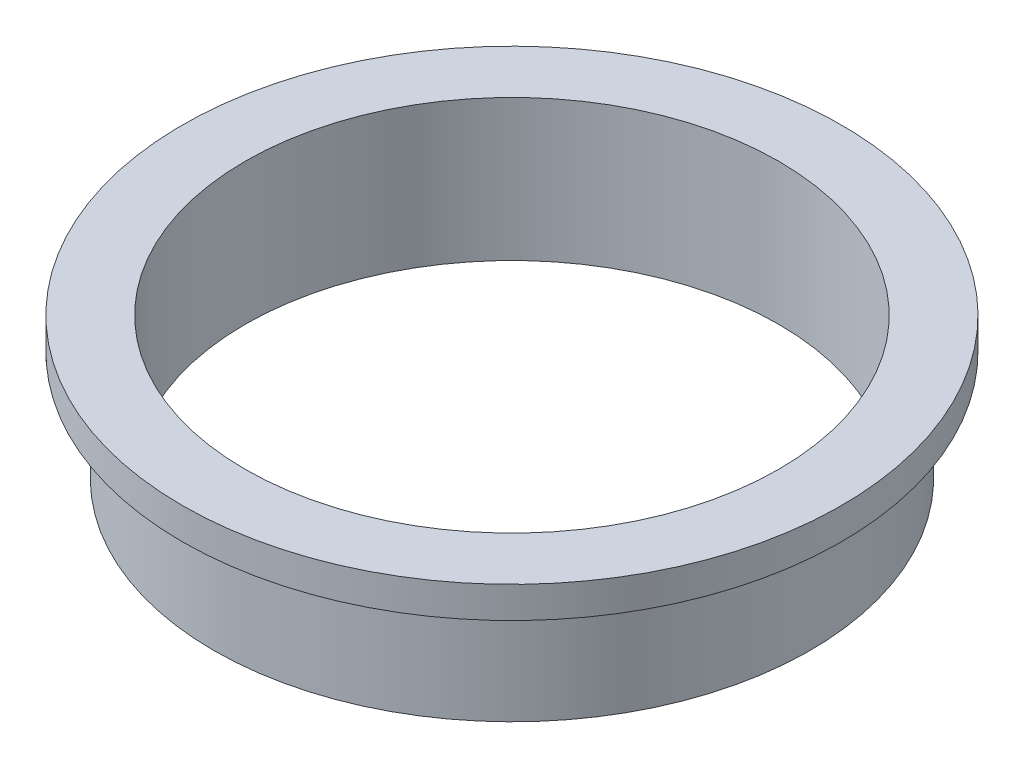
from build123d import *

# Parameters (mm, degrees)
CROQUIS1_R              = 9.5
CROQUIS1_R_2            = 8.5
SALIENTE_EXTRUIR1_DEPTH = 4.5
SALIENTE_EXTRUIR2_START = -1
CROQUIS2_R              = 10.5
CROQUIS2_R_2            = 8.5
SALIENTE_EXTRUIR2_DEPTH = 1


with BuildPart() as part:
    # Croquis1 → Saliente-Extruir1 (new body)
    with BuildSketch(Plane(origin=(0, 0, 0), x_dir=(1, 0, 0), z_dir=(0, 1, 0))):
        Circle(CROQUIS1_R)
        Circle(CROQUIS1_R_2, mode=Mode.SUBTRACT)
    extrude(amount=SALIENTE_EXTRUIR1_DEPTH)

    # Croquis2 → Saliente-Extruir2 (add)
    with BuildSketch(Plane(origin=(0, 4.5, 0), x_dir=(1, 0, 0), z_dir=(0, 1, 0)).offset(SALIENTE_EXTRUIR2_START)):
        Circle(CROQUIS2_R)
        Circle(CROQUIS2_R_2, mode=Mode.SUBTRACT)
    extrude(amount=SALIENTE_EXTRUIR2_DEPTH)


solid = part.part
